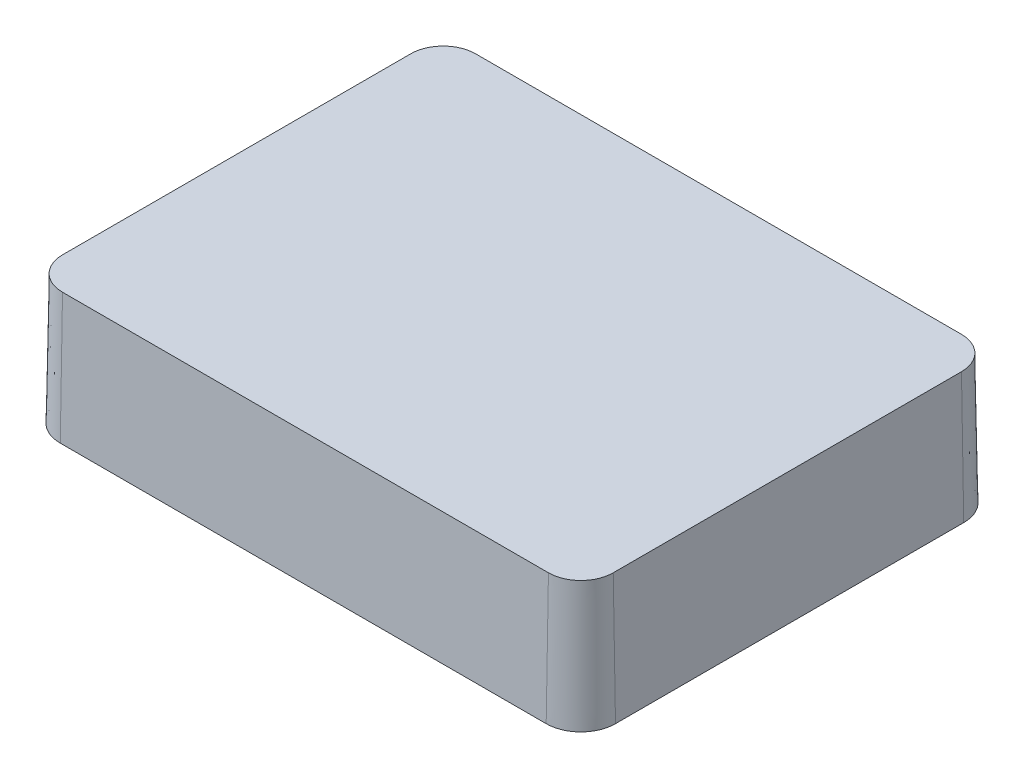
from build123d import *

# Parameters (mm, degrees)
BOSS_EXTRUDE1_DEPTH = 4
BOSS_EXTRUDE1_DRAFT = 1
SHELL1_T            = -0.5
SKETCH2_R           = 2
BOSS_EXTRUDE2_DEPTH = 5.5
BOSS_EXTRUDE2_TAPER = 1.5
CIRPATTERN1_COUNT   = 4


with BuildPart() as part:
    # Sketch1 → Boss-Extrude1 (with draft: the straight prism first)
    with BuildSketch(Plane(origin=(0, 0, 0), x_dir=(1, 0, 0), z_dir=(0, 1, 0))):
        with BuildLine():
            Line((-7.5, -6.375), (7.5, -6.375))
            ThreePointArc((7.5, -6.375), (8.207106781, -6.082106781), (8.5, -5.375))
            Line((8.5, -5.375), (8.5, 5.375))
            ThreePointArc((8.5, 5.375), (8.207106781, 6.082106781), (7.5, 6.375))
            Line((7.5, 6.375), (-7.5, 6.375))
            ThreePointArc((-7.5, 6.375), (-8.207106781, 6.082106781), (-8.5, 5.375))
            Line((-8.5, 5.375), (-8.5, -5.375))
            ThreePointArc((-8.5, -5.375), (-8.207106781, -6.082106781), (-7.5, -6.375))
        make_face()
    extrude(amount=-BOSS_EXTRUDE1_DEPTH)
    # Boss-Extrude1: the draft: its side faces are tilted about the plane it starts from
    boss_extrude1_sides = [part.faces().sort_by_distance(p)[0] for p in [
        (0, -2, 6.375),
        (8.207106781, -2, 6.082106781),
        (8.5, -2, 0),
        (8.207106781, -2, -6.082106781),
        (0, -2, -6.375),
        (-8.207106781, -2, -6.082106781),
        (-8.5, -2, 0),
        (-8.207106781, -2, 6.082106781),
    ]]
    draft(boss_extrude1_sides, Plane(origin=(0, 0, 0), x_dir=(1, 0, 0), z_dir=(0, 1, 0)), BOSS_EXTRUDE1_DRAFT)

    # Shell1
    shell1_openings = [part.faces().sort_by_distance(p)[0] for p in [
        (0, -4, 0),
    ]]
    offset(amount=SHELL1_T, openings=shell1_openings, kind=Kind.INTERSECTION)

    # Sketch2 → Boss-Extrude2 (add)
    with BuildSketch(Plane.XZ.offset(0.5)):
        Circle(SKETCH2_R)
    extrude(amount=BOSS_EXTRUDE2_DEPTH, taper=BOSS_EXTRUDE2_TAPER)

    # Rib1: read off the stored shape, not the designer's step
    # Rib1: loft between two sections, ruled curve by curve
    rib1_from = [
        Edge.make_line((1.982020214, -0.5, 0.267574046), (3, -0.5, 0.25)),
        Edge.make_line((1.982020214, -0.5, -0.267574046), (3, -0.5, -0.25)),
        Edge.make_line((3, -0.5, -0.25), (3, -0.5, 0.25)),
        Edge.make_line((1.982020214, -0.5, -0.267574046), (1.982020214, -0.5, 0.267574046)),
    ]
    rib1_to = [
        Edge.make_line((1.877466543, -4.5, 0.259067318), (2.402692557, -4.5, 0.25)),
        Edge.make_line((1.877466543, -4.5, -0.259067318), (2.402692557, -4.5, -0.25)),
        Edge.make_line((2.402692557, -4.5, -0.25), (2.402692557, -4.5, 0.25)),
        Edge.make_line((1.877466543, -4.5, -0.259067318), (1.877466543, -4.5, 0.259067318)),
    ]
    rib1 = Solid(Shell([*[Face.make_surface_from_curves(rib1_from[k], rib1_to[k]) for k in range(4)], Face(Wire(rib1_from)), Face(Wire(rib1_to))]))
    add(rib1)

    # CirPattern1: Rib1 ×4 about axis
    cirpattern1_axis = Axis((0, 0, 0), (0, 1, 0))
    for i in range(1, CIRPATTERN1_COUNT):
        add(rib1.rotate(cirpattern1_axis, i * 360 / CIRPATTERN1_COUNT))


solid = part.part
